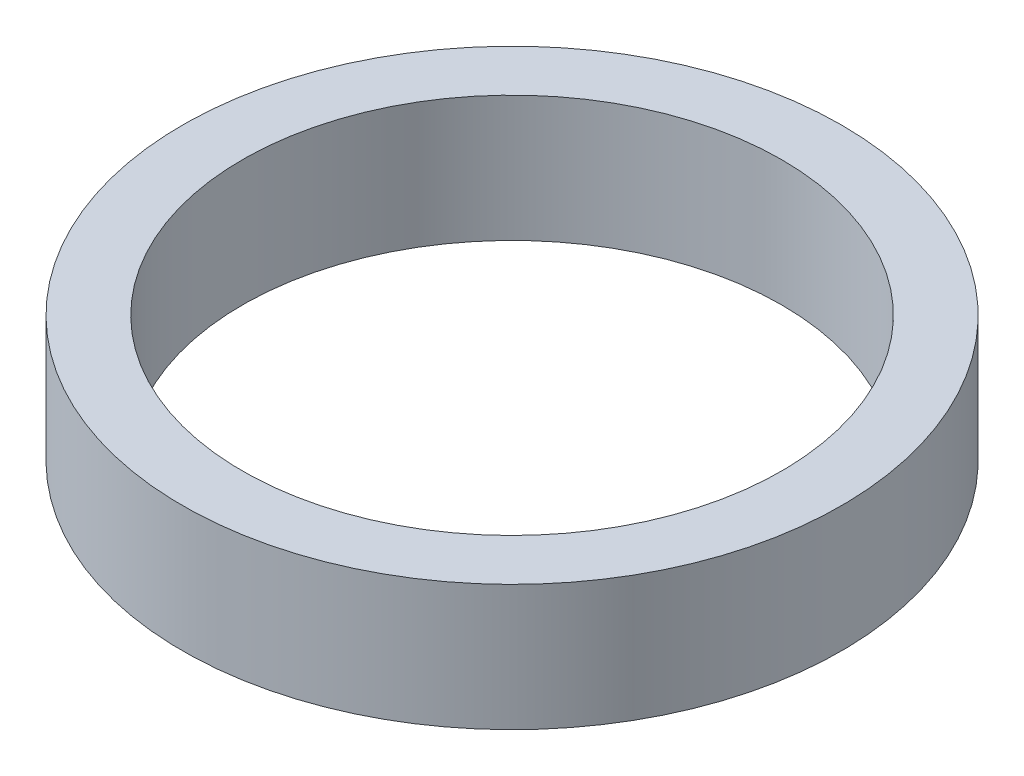
from build123d import *

# Parameters (mm, degrees)
SKETCH1_R           = 55
BOSS_EXTRUDE1_DEPTH = 21
SKETCH2_R           = 45
CUT_EXTRUDE1_DEPTH  = 81.566742518


with BuildPart() as part:
    # Sketch1 → Boss-Extrude1 (new body)
    with BuildSketch(Plane(origin=(0, 0, 0), x_dir=(1, 0, 0), z_dir=(0, 1, 0))):
        Circle(SKETCH1_R)
    extrude(amount=BOSS_EXTRUDE1_DEPTH)

    # Sketch2 → Cut-Extrude1 (cut, through all)
    with BuildSketch(Plane(origin=(0, 0, 0), x_dir=(1, 0, 0), z_dir=(0, 1, 0))):
        Circle(SKETCH2_R)
    extrude(amount=CUT_EXTRUDE1_DEPTH, mode=Mode.SUBTRACT)


solid = part.part
